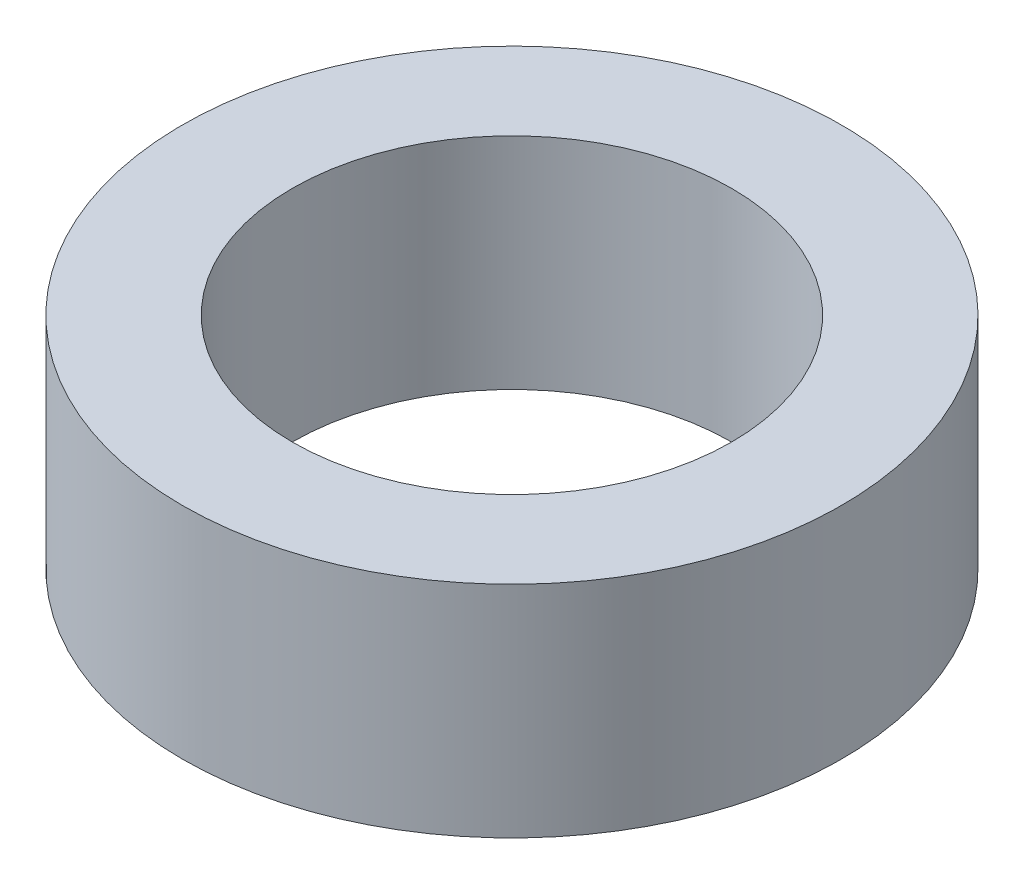
from build123d import *

# Parameters (mm, degrees)
SKETCH1_R           = 37.5
BOSS_EXTRUDE1_DEPTH = 25
SKETCH2_R           = 25
CUT_EXTRUDE1_DEPTH  = 59.630196998


with BuildPart() as part:
    # Sketch1 → Boss-Extrude1 (new body)
    with BuildSketch(Plane(origin=(0, 0, 0), x_dir=(1, 0, 0), z_dir=(0, 1, 0))):
        Circle(SKETCH1_R)
    extrude(amount=BOSS_EXTRUDE1_DEPTH)

    # Sketch2 → Cut-Extrude1 (cut, through all)
    with BuildSketch(Plane(origin=(0, 0, 0), x_dir=(1, 0, 0), z_dir=(0, 1, 0))):
        Circle(SKETCH2_R)
    extrude(amount=CUT_EXTRUDE1_DEPTH, mode=Mode.SUBTRACT)


solid = part.part
